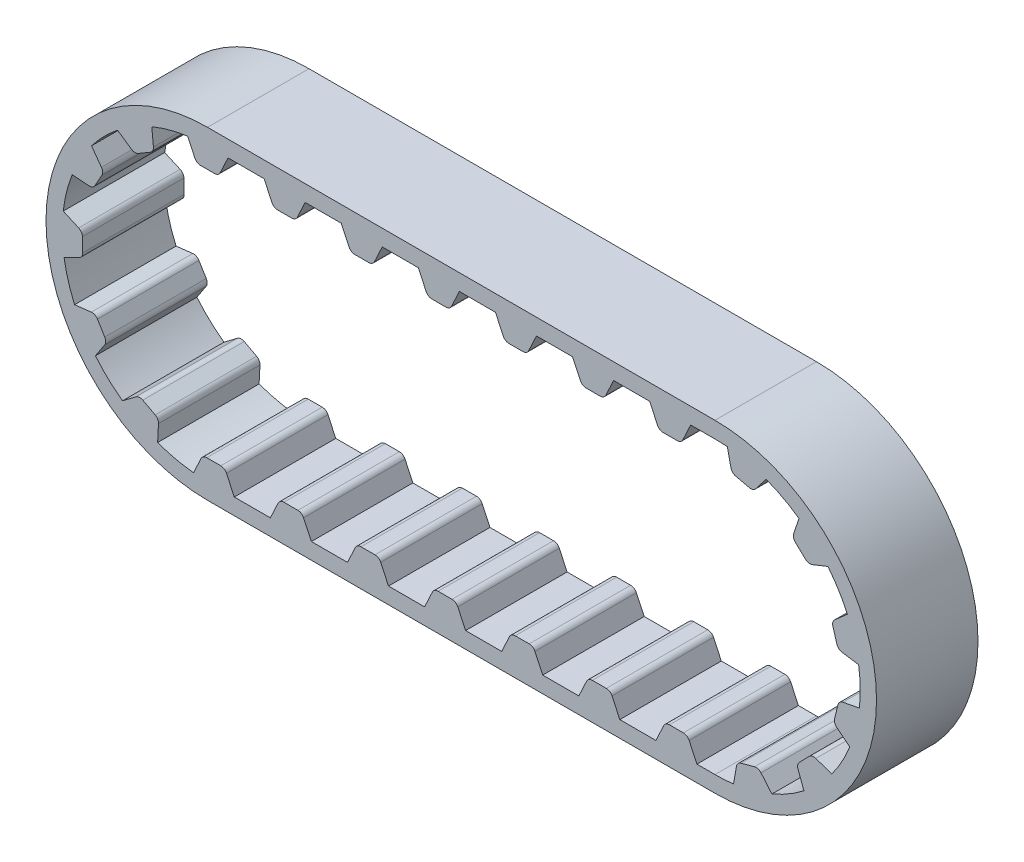
from build123d import *

# Parameters (mm, degrees)
BOSS_EXTRUDE1_DEPTH      = 3.175
BOSS_EXTRUDE1_DEPTH_BACK = 3.175
BOSS_EXTRUDE2_DEPTH      = 3.175
FILLET1_R                = 0.396875
CRVPATTERN1_START        = -3.175
CRVPATTERN1_DEPTH        = 6.35


# Read off the part's stored shape, not the designer's step: CrvPattern1
with BuildPart() as part:
    # Sketch4 → Boss-Extrude1 (new, two sides: drawn at the far end of the back side and taken through both)
    with BuildSketch(Plane.XY.offset(-BOSS_EXTRUDE1_DEPTH_BACK)):
        with BuildLine():
            Line((-15.875, -10.106338886), (15.875, -10.106338886))
            ThreePointArc((15.875, -10.106338886), (25.981338886, 0), (15.875, 10.106338886))
            Line((15.875, 10.106338886), (-15.875, 10.106338886))
            ThreePointArc((-15.875, 10.106338886), (-25.981338886, 0), (-15.875, -10.106338886))
        make_face()
        with BuildLine():
            Line((-15.875, -9.090338886), (15.875, -9.090338886))
            ThreePointArc((15.875, -9.090338886), (24.965338886, 0), (15.875, 9.090338886))
            Line((15.875, 9.090338886), (-15.875, 9.090338886))
            ThreePointArc((-15.875, 9.090338886), (-24.965338886, 0), (-15.875, -9.090338886))
        make_face(mode=Mode.SUBTRACT)
    extrude(amount=BOSS_EXTRUDE1_DEPTH + BOSS_EXTRUDE1_DEPTH_BACK)

    # Sketch5 → Boss-Extrude2 (add, symmetric)
    with BuildSketch(Plane.XY):
        Polygon((-17.1577, 9.090338886), (-16.565489274, 7.820338886), (-15.184510726, 7.820338886), (-14.5923, 9.090338886), align=None)
    extrude(amount=BOSS_EXTRUDE2_DEPTH, both=True)

    # Fillet1
    fillet1_edges = [part.edges().sort_by_distance(p)[0] for p in [
        (-16.565489274, 7.820338886, 0),
        (-15.184510726, 7.820338886, 0),
    ]]
    fillet(fillet1_edges, radius=FILLET1_R)

    # CrvPattern1 outline → CrvPattern1 (add)
    with BuildSketch(Plane.XY.offset(CRVPATTERN1_START)):
        with BuildLine():
            Line((-10.253005734, 8.049487264), (-9.767648651, 9.090338886))
            Line((-9.767648651, 9.090338886), (-12.333048651, 9.090338886))
            Line((-12.333048651, 9.090338886), (-11.847691568, 8.049487264))
            ThreePointArc((-11.847691568, 8.049487264), (-11.701241447, 7.882492906), (-11.488000665, 7.820338886))
            Line((-11.488000665, 7.820338886), (-10.612696636, 7.820338886))
            ThreePointArc((-10.612696636, 7.820338886), (-10.399455854, 7.882492906), (-10.253005734, 8.049487264))
        make_face()
        with BuildLine():
            Line((-5.428354384, 8.049487264), (-4.942997302, 9.090338886))
            Line((-4.942997302, 9.090338886), (-7.508397302, 9.090338886))
            Line((-7.508397302, 9.090338886), (-7.023040219, 8.049487264))
            ThreePointArc((-7.023040219, 8.049487264), (-6.876590098, 7.882492906), (-6.663349316, 7.820338886))
            Line((-6.663349316, 7.820338886), (-5.788045287, 7.820338886))
            ThreePointArc((-5.788045287, 7.820338886), (-5.574804505, 7.882492906), (-5.428354384, 8.049487264))
        make_face()
        with BuildLine():
            Line((-0.603703035, 8.049487264), (-0.118345953, 9.090338886))
            Line((-0.118345953, 9.090338886), (-2.683745953, 9.090338886))
            Line((-2.683745953, 9.090338886), (-2.19838887, 8.049487264))
            ThreePointArc((-2.19838887, 8.049487264), (-2.051938749, 7.882492906), (-1.838697967, 7.820338886))
            Line((-1.838697967, 7.820338886), (-0.963393938, 7.820338886))
            ThreePointArc((-0.963393938, 7.820338886), (-0.750153156, 7.882492906), (-0.603703035, 8.049487264))
        make_face()
        with BuildLine():
            Line((4.220948314, 8.049487264), (4.706305396, 9.090338886))
            Line((4.706305396, 9.090338886), (2.140905396, 9.090338886))
            Line((2.140905396, 9.090338886), (2.626262479, 8.049487264))
            ThreePointArc((2.626262479, 8.049487264), (2.7727126, 7.882492906), (2.985953382, 7.820338886))
            Line((2.985953382, 7.820338886), (3.861257411, 7.820338886))
            ThreePointArc((3.861257411, 7.820338886), (4.074498193, 7.882492906), (4.220948314, 8.049487264))
        make_face()
        with BuildLine():
            Line((9.045599663, 8.049487264), (9.530956746, 9.090338886))
            Line((9.530956746, 9.090338886), (6.965556746, 9.090338886))
            Line((6.965556746, 9.090338886), (7.450913828, 8.049487264))
            ThreePointArc((7.450913828, 8.049487264), (7.597363949, 7.882492906), (7.810604731, 7.820338886))
            Line((7.810604731, 7.820338886), (8.68590876, 7.820338886))
            ThreePointArc((8.68590876, 7.820338886), (8.899149542, 7.882492906), (9.045599663, 8.049487264))
        make_face()
        with BuildLine():
            ThreePointArc((-19.361191619, 8.395280166), (-20.476310819, 7.839783149), (-21.505006469, 7.137036376))
            Line((-21.505006469, 7.137036376), (-20.637109415, 6.538525434))
            ThreePointArc((-20.637109415, 6.538525434), (-20.426277877, 6.468633978), (-20.210911709, 6.522967824))
            Line((-20.210911709, 6.522967824), (-19.456023045, 6.966025663))
            ThreePointArc((-19.456023045, 6.966025663), (-19.303578615, 7.127566522), (-19.261804128, 7.345717033))
            Line((-19.261804128, 7.345717033), (-19.361191619, 8.395280166))
        make_face()
        with BuildLine():
            ThreePointArc((-23.131085894, 5.475717174), (-23.811619189, 4.43219324), (-24.343083918, 3.305422186))
            Line((-24.343083918, 3.305422186), (-23.291631416, 3.228556857))
            ThreePointArc((-23.291631416, 3.228556857), (-23.074426548, 3.274998203), (-22.916190738, 3.430870528))
            Line((-22.916190738, 3.430870528), (-22.489417143, 4.195083484))
            ThreePointArc((-22.489417143, 4.195083484), (-22.439712554, 4.411564908), (-22.514107512, 4.620849746))
            Line((-22.514107512, 4.620849746), (-23.131085894, 5.475717174))
        make_face()
        with BuildLine():
            ThreePointArc((-24.90454418, 1.049567989), (-24.963249967, -0.194868187), (-24.851256824, -1.435644276))
            Line((-24.851256824, -1.435644276), (-23.905545011, -0.969715304))
            ThreePointArc((-23.905545011, -0.969715304), (-23.741728456, -0.819719005), (-23.684159929, -0.605194838))
            Line((-23.684159929, -0.605194838), (-23.702923686, 0.26990805))
            ThreePointArc((-23.702923686, 0.26990805), (-23.769634632, 0.481767444), (-23.939730044, 0.624604079))
            Line((-23.939730044, 0.624604079), (-24.90454418, 1.049567989))
        make_face()
        with BuildLine():
            ThreePointArc((-24.193618017, -3.665358829), (-23.614344013, -4.768313675), (-22.889706739, -5.781708262))
            Line((-22.889706739, -5.781708262), (-22.309938308, -4.901180461))
            ThreePointArc((-22.309938308, -4.901180461), (-22.244582475, -4.688899119), (-22.303520607, -4.474747187))
            Line((-22.303520607, -4.474747187), (-22.762659064, -3.729529755))
            ThreePointArc((-22.762659064, -3.729529755), (-22.92743073, -3.580583283), (-23.146426624, -3.543494854))
            Line((-23.146426624, -3.543494854), (-24.193618017, -3.665358829))
        make_face()
        with BuildLine():
            ThreePointArc((-21.193911288, -7.371800578), (-20.136038665, -8.029807629), (-18.998133611, -8.536995813))
            Line((-18.998133611, -8.536995813), (-18.943825769, -7.48413718))
            ThreePointArc((-18.943825769, -7.48413718), (-18.994912631, -7.267977781), (-19.154141213, -7.113119744))
            Line((-19.154141213, -7.113119744), (-19.927327236, -6.702826535))
            ThreePointArc((-19.927327236, -6.702826535), (-20.144824424, -6.657774046), (-20.352466376, -6.736638315))
            Line((-20.352466376, -6.736638315), (-21.193911288, -7.371800578))
        make_face()
        with BuildLine():
            Line((-15.875, -9.090338886), (-14.202533769, -9.090338886))
            Line((-14.202533769, -9.090338886), (-14.687890852, -8.049487264))
            ThreePointArc((-14.687890852, -8.049487264), (-14.834340973, -7.882492906), (-15.047581755, -7.820338886))
            Line((-15.047581755, -7.820338886), (-15.922885784, -7.820338886))
            ThreePointArc((-15.922885784, -7.820338886), (-16.136126566, -7.882492906), (-16.282576687, -8.049487264))
            Line((-16.282576687, -8.049487264), (-16.748326317, -9.048290568))
            ThreePointArc((-16.748326317, -9.048290568), (-16.312168994, -9.079820721), (-15.875, -9.090338886))
        make_face()
        with BuildLine():
            Line((-11.94328242, -9.090338886), (-9.37788242, -9.090338886))
            Line((-9.37788242, -9.090338886), (-9.863239503, -8.049487264))
            ThreePointArc((-9.863239503, -8.049487264), (-10.009689624, -7.882492906), (-10.222930406, -7.820338886))
            Line((-10.222930406, -7.820338886), (-11.098234435, -7.820338886))
            ThreePointArc((-11.098234435, -7.820338886), (-11.311475217, -7.882492906), (-11.457925338, -8.049487264))
            Line((-11.457925338, -8.049487264), (-11.94328242, -9.090338886))
        make_face()
        with BuildLine():
            Line((-7.118631071, -9.090338886), (-4.553231071, -9.090338886))
            Line((-4.553231071, -9.090338886), (-5.038588154, -8.049487264))
            ThreePointArc((-5.038588154, -8.049487264), (-5.185038275, -7.882492906), (-5.398279057, -7.820338886))
            Line((-5.398279057, -7.820338886), (-6.273583085, -7.820338886))
            ThreePointArc((-6.273583085, -7.820338886), (-6.486823867, -7.882492906), (-6.633273988, -8.049487264))
            Line((-6.633273988, -8.049487264), (-7.118631071, -9.090338886))
        make_face()
        with BuildLine():
            Line((-2.293979722, -9.090338886), (0.271420278, -9.090338886))
            Line((0.271420278, -9.090338886), (-0.213936805, -8.049487264))
            ThreePointArc((-0.213936805, -8.049487264), (-0.360386925, -7.882492906), (-0.573627708, -7.820338886))
            Line((-0.573627708, -7.820338886), (-1.448931736, -7.820338886))
            ThreePointArc((-1.448931736, -7.820338886), (-1.662172518, -7.882492906), (-1.808622639, -8.049487264))
            Line((-1.808622639, -8.049487264), (-2.293979722, -9.090338886))
        make_face()
        with BuildLine():
            Line((2.530671627, -9.090338886), (5.096071627, -9.090338886))
            Line((5.096071627, -9.090338886), (4.610714545, -8.049487264))
            ThreePointArc((4.610714545, -8.049487264), (4.464264424, -7.882492906), (4.251023642, -7.820338886))
            Line((4.251023642, -7.820338886), (3.375719613, -7.820338886))
            ThreePointArc((3.375719613, -7.820338886), (3.162478831, -7.882492906), (3.01602871, -8.049487264))
            Line((3.01602871, -8.049487264), (2.530671627, -9.090338886))
        make_face()
        with BuildLine():
            Line((7.355322976, -9.090338886), (9.920722976, -9.090338886))
            Line((9.920722976, -9.090338886), (9.435365894, -8.049487264))
            ThreePointArc((9.435365894, -8.049487264), (9.288915773, -7.882492906), (9.075674991, -7.820338886))
            Line((9.075674991, -7.820338886), (8.200370962, -7.820338886))
            ThreePointArc((8.200370962, -7.820338886), (7.98713018, -7.882492906), (7.840680059, -8.049487264))
            Line((7.840680059, -8.049487264), (7.355322976, -9.090338886))
        make_face()
        with BuildLine():
            Line((12.179974325, -9.090338886), (14.745374325, -9.090338886))
            Line((14.745374325, -9.090338886), (14.260017243, -8.049487264))
            ThreePointArc((14.260017243, -8.049487264), (14.113567122, -7.882492906), (13.90032634, -7.820338886))
            Line((13.90032634, -7.820338886), (13.025022311, -7.820338886))
            ThreePointArc((13.025022311, -7.820338886), (12.811781529, -7.882492906), (12.665331408, -8.049487264))
            Line((12.665331408, -8.049487264), (12.179974325, -9.090338886))
        make_face()
        with BuildLine():
            ThreePointArc((17.037337708, -9.015721386), (18.259111517, -8.77213049), (19.436106047, -8.363778141))
            Line((19.436106047, -8.363778141), (18.755560531, -7.558595899))
            ThreePointArc((18.755560531, -7.558595899), (18.570439518, -7.435856484), (18.3483622, -7.431804559))
            Line((18.3483622, -7.431804559), (17.503698293, -7.661369424))
            ThreePointArc((17.503698293, -7.661369424), (17.314223085, -7.777274122), (17.216696864, -7.976832107))
            Line((17.216696864, -7.976832107), (17.037337708, -9.015721386))
        make_face()
        with BuildLine():
            ThreePointArc((21.440976424, -7.18708338), (22.371371253, -6.35857072), (23.179748795, -5.410628994))
            Line((23.179748795, -5.410628994), (22.185261885, -5.060691245))
            ThreePointArc((22.185261885, -5.060691245), (21.963480187, -5.048540865), (21.769903005, -5.157456557))
            Line((21.769903005, -5.157456557), (21.15763952, -5.782988785))
            ThreePointArc((21.15763952, -5.782988785), (21.05289854, -5.978856292), (21.069800428, -6.20032656))
            Line((21.069800428, -6.20032656), (21.440976424, -7.18708338))
        make_face()
        with BuildLine():
            ThreePointArc((24.31319506, -3.380994704), (24.696222523, -2.195516855), (24.913566467, -0.968801984))
            Line((24.913566467, -0.968801984), (23.878760814, -1.170390433))
            ThreePointArc((23.878760814, -1.170390433), (23.681339341, -1.272172137), (23.569523029, -1.464088435))
            Line((23.569523029, -1.464088435), (23.358117846, -2.313479389))
            ThreePointArc((23.358117846, -2.313479389), (23.366929477, -2.535418814), (23.493609097, -2.717866141))
            Line((23.493609097, -2.717866141), (24.31319506, -3.380994704))
        make_face()
        with BuildLine():
            ThreePointArc((24.86373276, 1.355339231), (24.594006864, 2.571610462), (24.160517302, 3.739580738))
            Line((24.160517302, 3.739580738), (23.370108837, 3.041931041))
            ThreePointArc((23.370108837, 3.041931041), (23.251366038, 2.854221422), (23.252075681, 2.632108276))
            Line((23.252075681, 2.632108276), (23.499694722, 1.792559616))
            ThreePointArc((23.499694722, 1.792559616), (23.619634536, 1.605612579), (23.821237318, 1.512386663))
            Line((23.821237318, 1.512386663), (24.86373276, 1.355339231))
        make_face()
        with BuildLine():
            ThreePointArc((22.941114845, 5.718765781), (22.092847844, 6.631186112), (21.127794886, 7.419057012))
            Line((21.127794886, 7.419057012), (20.799256214, 6.417297069))
            ThreePointArc((20.799256214, 6.417297069), (20.791862925, 6.195305869), (20.904903274, 6.00410798))
            Line((20.904903274, 6.00410798), (21.543416754, 5.405394628))
            ThreePointArc((21.543416754, 5.405394628), (21.741484568, 5.304876498), (21.96254162, 5.326522127))
            Line((21.96254162, 5.326522127), (22.941114845, 5.718765781))
        make_face()
        with BuildLine():
            ThreePointArc((19.074329485, 8.508733861), (17.880913154, 8.8662604), (16.649821008, 9.057257503))
            Line((16.649821008, 9.057257503), (16.873546101, 8.027011064))
            ThreePointArc((16.873546101, 8.027011064), (16.979536509, 7.831816836), (17.173805695, 7.724140298))
            Line((17.173805695, 7.724140298), (18.027533322, 7.530991958))
            ThreePointArc((18.027533322, 7.530991958), (18.249232853, 7.544559245), (18.428922644, 7.67512085))
            Line((18.428922644, 7.67512085), (19.074329485, 8.508733861))
        make_face()
        with BuildLine():
            Line((12.63525608, 7.820338886), (13.510560109, 7.820338886))
            ThreePointArc((13.510560109, 7.820338886), (13.723800891, 7.882492906), (13.870251012, 8.049487264))
            Line((13.870251012, 8.049487264), (14.355608095, 9.090338886))
            Line((14.355608095, 9.090338886), (11.790208095, 9.090338886))
            Line((11.790208095, 9.090338886), (12.275565177, 8.049487264))
            ThreePointArc((12.275565177, 8.049487264), (12.422015298, 7.882492906), (12.63525608, 7.820338886))
        make_face()
    extrude(amount=CRVPATTERN1_DEPTH)


solid = part.part
